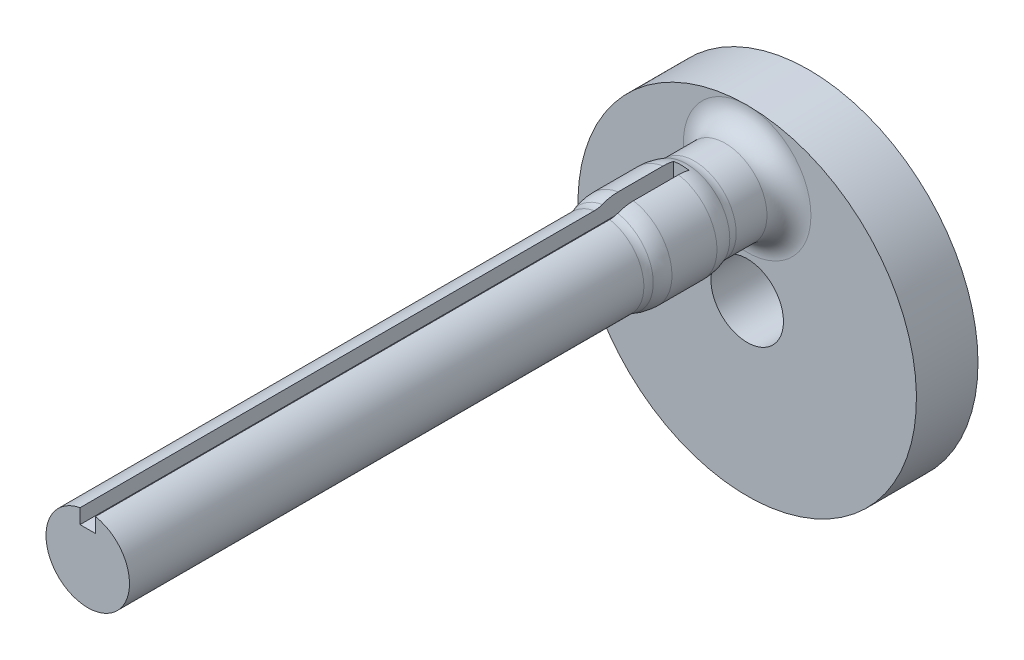
from build123d import *

# Parameters (mm, degrees)
ESQUISSE1_R             = 7.7
BOSS_EXTRU_1_DEPTH      = 2.8
ESQUISSE2_R             = 1.9
BOSS_EXTRU_2_DEPTH      = 30
ESQUISSE3_R             = 1.65
ENL_V_MAT_EXTRU_1_DEPTH = 32.91520014
CONG_2_R                = 1
ESQUISSE4_R             = 2.1
ESQUISSE4_R_2           = 1.9
BOSS_EXTRU_3_DEPTH      = 3
CONG_3_R                = 1
CONG_4_R                = 2
ESQUISSE5_W             = 0.7
ESQUISSE5_H             = 1.4
ENL_V_MAT_EXTRU_2_DEPTH = 30.113227234


# Some blends are built 0.0001 mm under size
with BuildPart() as part:
    # Esquisse1 → Boss.-Extru.1 (new body)
    with BuildSketch(Plane.XY):
        Circle(ESQUISSE1_R)
    extrude(amount=BOSS_EXTRU_1_DEPTH)

    # Esquisse2 → Boss.-Extru.2 (add)
    with BuildSketch(Plane.XY.offset(2.8)):
        with Locations((0, 4.8)):
            Circle(ESQUISSE2_R)
    extrude(amount=BOSS_EXTRU_2_DEPTH)

    # Esquisse3 → Enlèv. mat.-Extru.1 (cut, through all)
    with BuildSketch(Plane.XY.offset(2.8)):
        Circle(ESQUISSE3_R)
    extrude(amount=-ENL_V_MAT_EXTRU_1_DEPTH, mode=Mode.SUBTRACT)

    # Congé2
    cong_2_edges = [part.edges().sort_by_distance(p)[0] for p in [
        (-1.9, 4.8, 2.8),
    ]]
    fillet(cong_2_edges, radius=CONG_2_R - 0.0001)  # a hair under: the kernel refuses the full size

    # Esquisse4 → Boss.-Extru.3 (add)
    with BuildSketch(Plane.XY.offset(5.8)):
        with Locations((0, 4.8)):
            Circle(ESQUISSE4_R)
        with Locations((0, 4.8)):
            Circle(ESQUISSE4_R_2, mode=Mode.SUBTRACT)
    extrude(amount=BOSS_EXTRU_3_DEPTH)

    # Congé3
    # the kernel refuses this fillet: 1 mm, written as the material it adds along each edge
    with BuildSketch(Plane(origin=(0, 4.8, 5.8), x_dir=(1, 0, 0), z_dir=(0, -1, 0))) as cong_3_piece_1:
        with BuildLine():
            CenterArc((2.9, -0.6), CONG_3_R, 143.130102354, 36.869897646)
            Line((2.1, 0), (2.084, 0.012))
            ThreePointArc((2.084, 0.012), (2, 0.02), (1.9, 0.02))
            Line((1.9, 0.02), (1.88, 0))
            Line((1.88, 0), (1.88, -0.6))
            Line((1.88, -0.6), (1.9, -0.6))
        make_face()
    revolve(axis=Axis((0, 4.8, 5.8), (0, 0, 1)))
    with BuildSketch(Plane(origin=(0, 4.8, 8.8), x_dir=(1, 0, 0), z_dir=(0, -1, 0))) as cong_3_piece_2:
        with BuildLine():
            CenterArc((2.9, 0.6), CONG_3_R, 180, 36.869897646)
            Line((1.9, 0.6), (1.88, 0.6))
            Line((1.88, 0.6), (1.88, 0))
            Line((1.88, 0), (1.9, -0.02))
            ThreePointArc((1.9, -0.02), (2, -0.02), (2.084, -0.012))
            Line((2.084, -0.012), (2.1, 0))
        make_face()
    revolve(axis=Axis((0, 4.8, 8.8), (0, 0, 1)))

    # Congé4
    cong_4_edges = [part.edges().sort_by_distance(p)[0] for p in [
        (-2.1, 4.8, 8.8),
        (-2.1, 4.8, 5.8),
    ]]
    fillet(cong_4_edges, radius=CONG_4_R)

    # Esquisse5 → Enlèv. mat.-Extru.2 (cut, through all)
    with BuildSketch(Plane.XY.offset(5.8)):
        with Locations((0, 6.7)):
            Rectangle(ESQUISSE5_W, ESQUISSE5_H)
    extrude(amount=ENL_V_MAT_EXTRU_2_DEPTH, mode=Mode.SUBTRACT)


solid = part.part
